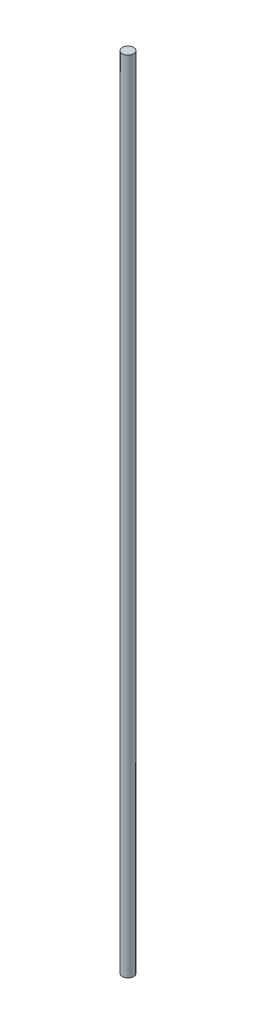
from build123d import *

# Parameters (mm, degrees)
SZKIC1_R                    = 4
DODANIE_WYCI_GNI_CIE1_DEPTH = 570


with BuildPart() as part:
    # Szkic1 → Dodanie-wyciągnięcie1 (new body)
    with BuildSketch(Plane(origin=(0, 0, 0), x_dir=(1, 0, 0), z_dir=(0, 1, 0))):
        Circle(SZKIC1_R)
    extrude(amount=DODANIE_WYCI_GNI_CIE1_DEPTH)


solid = part.part
